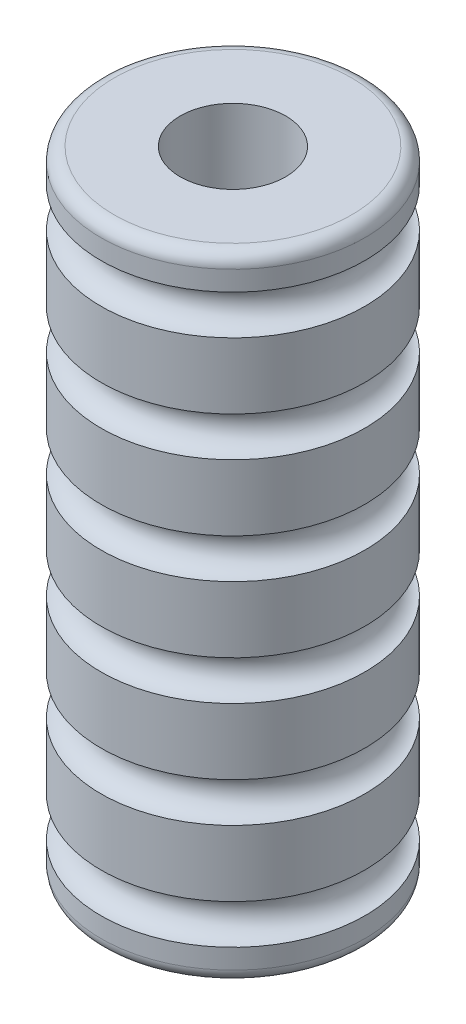
from build123d import *

# Parameters (mm, degrees)
CUT_EXTRUDE1_REACH = 160.877
SKETCH2_R          = 12.7


with BuildPart() as part:
    # Sketch1 → Revolve1 (revolve)
    with BuildSketch(Plane(origin=(0, 0, 0), x_dir=(0, 0, -1), z_dir=(1, 0, 0))):
        with BuildLine():
            Line((31.75, 144.4625), (31.75, 149.225))
            ThreePointArc((31.75, 149.225), (30.82006403, 151.47006403), (28.575, 152.4))
            Line((28.575, 152.4), (0, 152.4))
            Line((0, 152.4), (0, 0))
            Line((0, 0), (28.575, 0))
            ThreePointArc((28.575, 0), (30.82006403, 0.92993597), (31.75, 3.175))
            Line((31.75, 3.175), (31.75, 7.9375))
            ThreePointArc((31.75, 7.9375), (26.9875, 12.7), (31.75, 17.4625))
            Line((31.75, 17.4625), (31.75, 33.3375))
            ThreePointArc((31.75, 33.3375), (26.9875, 38.1), (31.75, 42.8625))
            Line((31.75, 42.8625), (31.75, 58.7375))
            ThreePointArc((31.75, 58.7375), (26.9875, 63.5), (31.75, 68.2625))
            Line((31.75, 68.2625), (31.75, 84.1375))
            ThreePointArc((31.75, 84.1375), (26.9875, 88.9), (31.75, 93.6625))
            Line((31.75, 93.6625), (31.75, 109.5375))
            ThreePointArc((31.75, 109.5375), (26.9875, 114.3), (31.75, 119.0625))
            Line((31.75, 119.0625), (31.75, 134.9375))
            ThreePointArc((31.75, 134.9375), (26.9875, 139.7), (31.75, 144.4625))
        make_face()
    revolve(axis=Axis((0, 0, 0), (0, 1, 0)))

    # Sketch2 → Cut-Extrude1 (cut, up to next)
    with BuildSketch(Plane.XZ, mode=Mode.PRIVATE) as cut_extrude1_sk1:
        Circle(SKETCH2_R)
    cut_extrude1_tool1 = extrude(cut_extrude1_sk1.sketch, amount=-CUT_EXTRUDE1_REACH, mode=Mode.PRIVATE) & part.part
    add(cut_extrude1_tool1.solids().sort_by_distance((0, 0, 0))[0], mode=Mode.SUBTRACT)


solid = part.part
